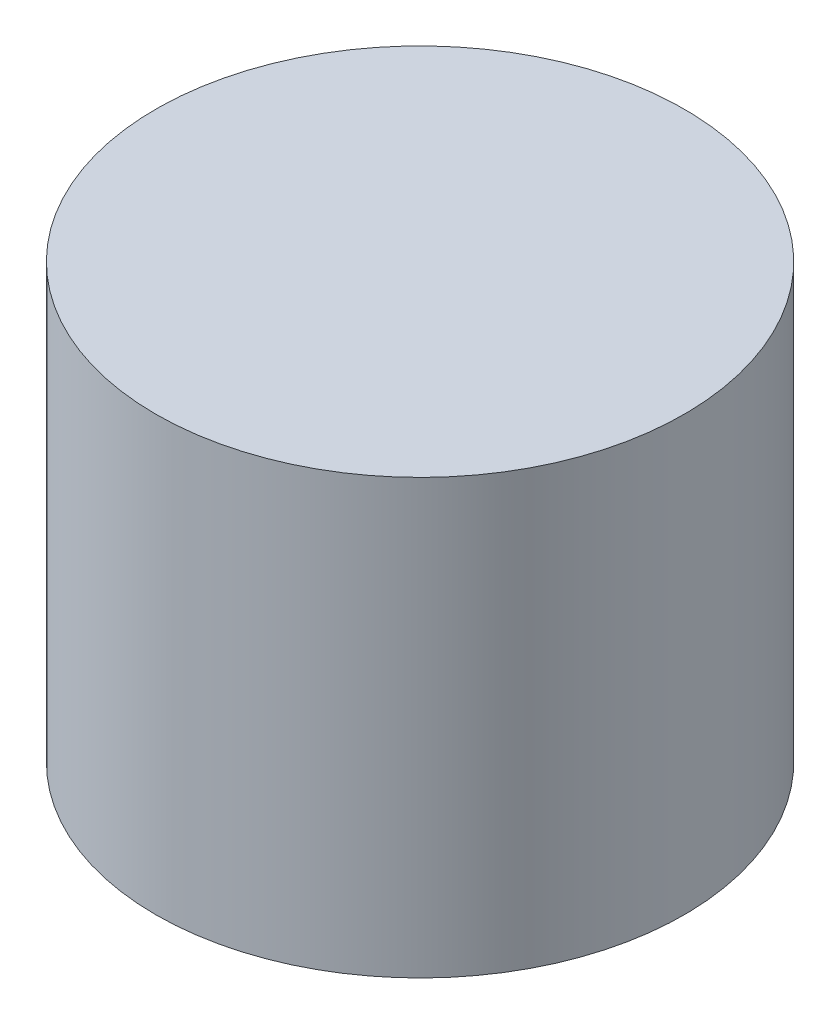
from build123d import *

# Parameters (mm, degrees)
SKETCH1_R           = 32
BOSS_EXTRUDE1_DEPTH = 26.25


with BuildPart() as part:
    # Sketch1 → Boss-Extrude1 (new, symmetric)
    with BuildSketch(Plane(origin=(0, 0, 0), x_dir=(1, 0, 0), z_dir=(0, 1, 0))):
        Circle(SKETCH1_R)
    extrude(amount=BOSS_EXTRUDE1_DEPTH, both=True)


solid = part.part
